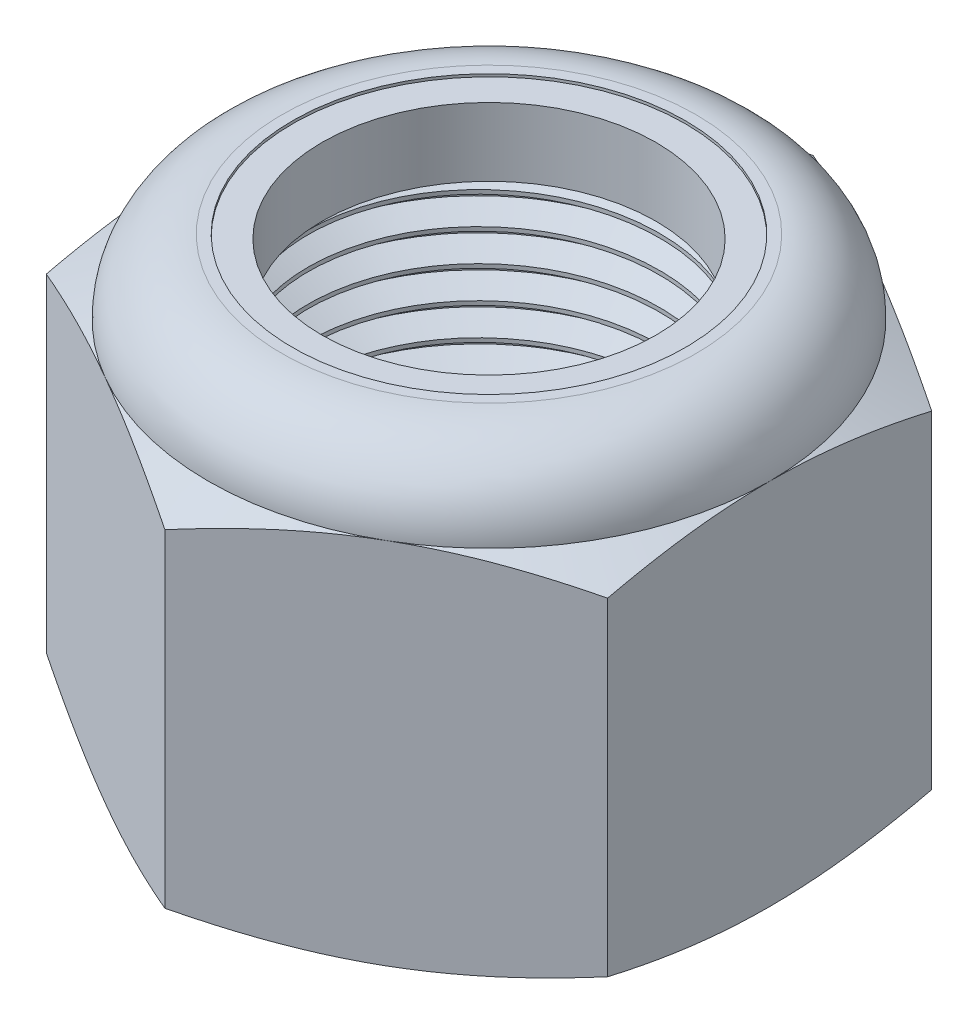
from build123d import *

# Parameters (mm, degrees)
SKETCH1_R        = 11.1125
EXTRUDE1_DEPTH   = 25.003125
SKETCH2_W        = 11.1125
SKETCH2_H        = 20.8359375
CUT_SWEEP1_PITCH = 1.814285714
SKETCH12_W       = 12.22375
SKETCH12_H       = 20.8359375


with BuildPart() as part:
    # Sketch1 → Extrude1 (new body)
    with BuildSketch(Plane(origin=(0, 0, 0), x_dir=(1, 0, 0), z_dir=(0, 1, 0))):
        Polygon((0, 18.330871047), (-15.875, 9.165435523), (-15.875, -9.165435523), (0, -18.330871047), (15.875, -9.165435523), (15.875, 9.165435523), align=None)
        with Locations(Location((0, 0, 0), (0, 0, 90))):
            Circle(SKETCH1_R, mode=Mode.SUBTRACT)
    extrude(amount=EXTRUDE1_DEPTH)

    # Sketch5 → Cut-Revolve3 (revolve, cut)
    with BuildSketch(Plane(origin=(0, 0, 0), x_dir=(0, 0, -1), z_dir=(1, 0, 0))):
        with BuildLine():
            Line((0, 0), (15.875, 0))
            Line((15.875, 0), (18.330871047, 1.145191477))
            Line((18.330871047, 1.145191477), (18.330871047, 19.690746023))
            Line((18.330871047, 19.690746023), (15.875, 20.8359375))
            ThreePointArc((15.875, 20.8359375), (14.65445904, 23.78258404), (11.7078125, 25.003125))
            Line((11.7078125, 25.003125), (11.7078125, 26.273125))
            Line((11.7078125, 26.273125), (19.600871047, 26.273125))
            Line((19.600871047, 26.273125), (19.600871047, -1.27))
            Line((19.600871047, -1.27), (0, -1.27))
            Line((0, -1.27), (0, 0))
        make_face()
    revolve(axis=Axis((0, 0, 0), (0, 1, 0)), mode=Mode.SUBTRACT)

    # Sketch6 → Cut-Revolve4 (revolve, cut)
    with BuildSketch(Plane(origin=(0, 0, 0), x_dir=(0, 0, -1), z_dir=(1, 0, 0))):
        with BuildLine():
            Line((0, 20.8359375), (15.7226, 20.8359375))
            ThreePointArc((15.7226, 20.8359375), (14.546695966, 23.674820966), (11.7078125, 24.850725))
            Line((11.7078125, 24.850725), (5.85390625, 24.850725))
            Line((5.85390625, 24.850725), (5.85390625, 26.273125))
            Line((5.85390625, 26.273125), (0, 26.273125))
            Line((0, 26.273125), (0, 20.8359375))
        make_face()
    revolve(axis=Axis((0, 26.273125, 0), (0, -1, 0)), mode=Mode.SUBTRACT)

    # Sketch4 → Cut-Revolve2 (revolve, cut)
    with BuildSketch(Plane(origin=(0, 0, 0), x_dir=(0, 0, -1), z_dir=(1, 0, 0))):
        Polygon((0, 20.8359375), (12.22375, 20.8359375), (0, 15.135909264), align=None)
        Polygon((0, 5.700028236), (12.22375, 0), (0, 0), align=None)
    revolve(axis=Axis((0, 0, 0), (0, 1, 0)), mode=Mode.SUBTRACT)

    # Sketch12 → Revolve4 (revolve)
    with BuildSketch(Plane(origin=(0, 0, 0), x_dir=(0, 0, -1), z_dir=(1, 0, 0)), mode=Mode.PRIVATE) as revolve4_sk:
        with Locations((6.111875, 10.41796875)):
            Rectangle(SKETCH12_W, SKETCH12_H)
    revolve(revolve4_sk.sketch.rotate(Axis((0, 0, 0), (0, 1, 0)), 180), axis=Axis((0, 0, 0), (0, 1, 0)))


with BuildPart() as body_2:
    # Sketch7 → Revolve2 (revolve)
    with BuildSketch(Plane(origin=(0, 0, 0), x_dir=(0, 0, -1), z_dir=(1, 0, 0))):
        with BuildLine():
            Line((9.445625, 20.9121375), (15.645662809, 20.9121375))
            ThreePointArc((15.645662809, 20.9121375), (14.465742079, 23.647751137), (11.7078125, 24.774525))
            Line((11.7078125, 24.774525), (9.445625, 24.774525))
            Line((9.445625, 24.774525), (9.445625, 20.9121375))
        make_face()
    revolve(axis=Axis((0, 20.9121375, 0), (0, 1, 0)))


with BuildPart() as body_3:
    # Sketch2 → Revolve1 (revolve)
    with BuildSketch(Plane(origin=(0, 0, 0), x_dir=(0, 0, -1), z_dir=(1, 0, 0)), mode=Mode.PRIVATE) as revolve1_sk:
        with Locations((5.55625, 10.41796875)):
            Rectangle(SKETCH2_W, SKETCH2_H)
    revolve(revolve1_sk.sketch.rotate(Axis((0, -11.1125, 0), (0, 1, 0)), 180), axis=Axis((0, -11.1125, 0), (0, 1, 0)))

    # Cut-Sweep1: the profile of Sketch9 screwed along a right-hand helix of 14.78125 turns, 10 arcs to a turn; built about Z, then put on its axis
    cut_sweep1_z = Axis((0, 0, 0), (0, 0, 1))
    cut_sweep1_corners = [(11.30890219, 0, 0.113392857), (11.210701095, 0, -1.644196429), (9.934086861, 0, -0.907142857), (9.934086861, 0, -0.680357143)]
    with BuildLine(mode=Mode.PRIVATE) as cut_sweep1_profile:
        Line(cut_sweep1_corners[0], cut_sweep1_corners[1])
        Line(cut_sweep1_corners[1], cut_sweep1_corners[2])
        Line(cut_sweep1_corners[2], cut_sweep1_corners[3])
        Line(cut_sweep1_corners[3], cut_sweep1_corners[0])
    cut_sweep1_cap = Face(cut_sweep1_profile.wire())
    cut_sweep1_turn_angles = [0, 18, 36, 54, 72, 90, 108, 126, 144, 162, 180, 198, 216, 234, 252, 270, 288, 306, 324, 342, 360]
    cut_sweep1_turn_weights = [1, 0.9510565162951535, 1, 0.9510565162951535, 1, 0.9510565162951535, 1, 0.9510565162951535, 1, 0.9510565162951535, 1, 0.9510565162951535, 1, 0.9510565162951535, 1, 0.9510565162951535, 1, 0.9510565162951535, 1, 0.9510565162951535, 1]
    cut_sweep1_turn_rails = [Edge.make_bspline([Vector(p[0], p[1], 0).rotate(cut_sweep1_z, cut_sweep1_turn_angles[k]) / cut_sweep1_turn_weights[k] + Vector(0, 0, p[2] + CUT_SWEEP1_PITCH * cut_sweep1_turn_angles[k] / 360) for k in range(21)], [0, 0, 0, 1, 1, 2, 2, 3, 3, 4, 4, 5, 5, 6, 6, 7, 7, 8, 8, 9, 9, 10, 10, 10], 2, cut_sweep1_turn_weights) for p in cut_sweep1_corners]
    cut_sweep1_turn_sides = [Face.make_surface_from_curves(cut_sweep1_turn_rails[p[0]], cut_sweep1_turn_rails[p[1]]) for p in [(0, 1), (1, 2), (2, 3), (3, 0)]]
    cut_sweep1_last_angles = [5040, 5058, 5076, 5094, 5112, 5130, 5148, 5166, 5184, 5202, 5220, 5238, 5256, 5274, 5292, 5306.625, 5321.25]
    cut_sweep1_last_weights = [1, 0.9510565162951535, 1, 0.9510565162951535, 1, 0.9510565162951535, 1, 0.9510565162951535, 1, 0.9510565162951535, 1, 0.9510565162951535, 1, 0.9510565162951535, 1, 0.9675990923602338, 1]
    cut_sweep1_last_rails = [Edge.make_bspline([Vector(p[0], p[1], 0).rotate(cut_sweep1_z, cut_sweep1_last_angles[k]) / cut_sweep1_last_weights[k] + Vector(0, 0, p[2] + CUT_SWEEP1_PITCH * cut_sweep1_last_angles[k] / 360) for k in range(17)], [0, 0, 0, 1, 1, 2, 2, 3, 3, 4, 4, 5, 5, 6, 6, 7, 7, 8, 8, 8], 2, cut_sweep1_last_weights) for p in cut_sweep1_corners]
    cut_sweep1_last_sides = [Face.make_surface_from_curves(cut_sweep1_last_rails[p[0]], cut_sweep1_last_rails[p[1]]) for p in [(0, 1), (1, 2), (2, 3), (3, 0)]]
    cut_sweep1 = Plane(origin=(0, 20.8359375, 0), x_dir=(0, 0, -1), z_dir=(0, -1, 0)) * Solid(Shell([*[p.moved(Location((0, 0, CUT_SWEEP1_PITCH * i))) for i in range(14) for p in cut_sweep1_turn_sides], *cut_sweep1_last_sides, cut_sweep1_cap, cut_sweep1_cap.rotate(cut_sweep1_z, 5321.25).moved(Location((0, 0, CUT_SWEEP1_PITCH * 5321.25 / 360)))]))
    add(cut_sweep1, mode=Mode.SUBTRACT)

    # Sketch11 → Revolve3 (revolve)
    with BuildSketch(Plane(origin=(0, 0, 0), x_dir=(0, 0, -1), z_dir=(1, 0, 0)), mode=Mode.PRIVATE) as revolve3_sk:
        Polygon((0, 0), (12.22375, 0), (0, 5.700028236), align=None)
    revolve(revolve3_sk.sketch.rotate(Axis((0, 25.003125, 0), (0, -1, 0)), 26.44468473), axis=Axis((0, 25.003125, 0), (0, -1, 0)))


with BuildPart() as part_1:
    add(part.part)

    # Combine1: cut body 3
    add(body_3.part, mode=Mode.SUBTRACT)


solid = Compound([body_2.part, part_1.part])
